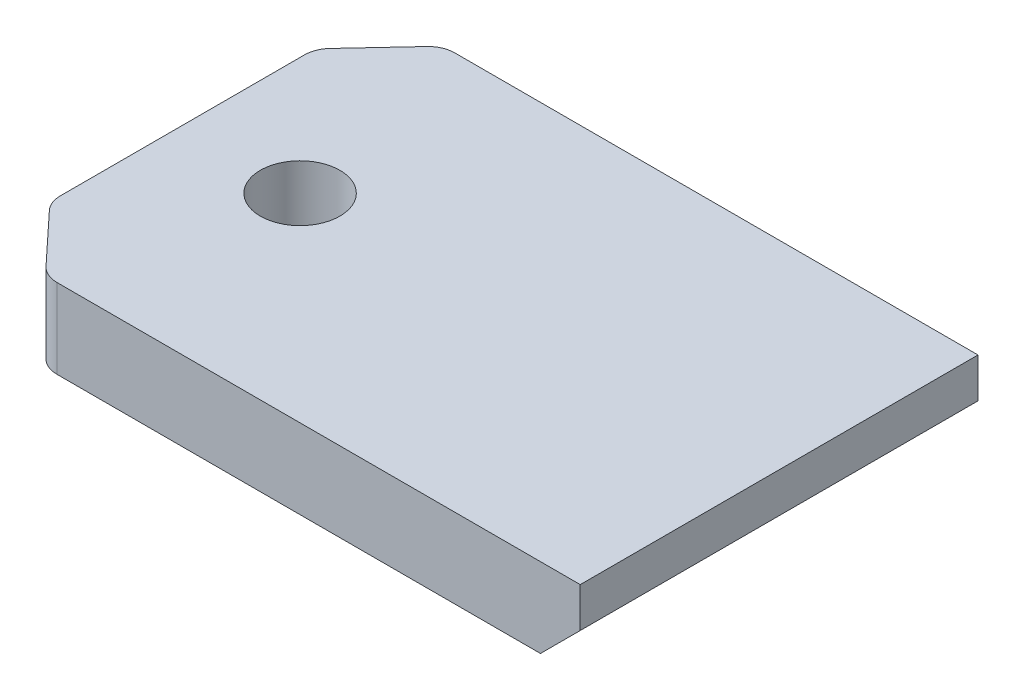
from build123d import *

# Parameters (mm, degrees)
SKETCH_1_W          = 30
SKETCH_1_H          = 6
EXTRUDE_1_DEPTH     = 45
CHAMFER_1_SIZE      = 3
SKETCH_2_R          = 3
CUT_EXTRUDE_1_DEPTH = 55.415071442
CHAMFER_2_SIZE      = 5
CHAMFER_2_SIZE2     = 4.662575431
FILLET_1_R          = 2


with BuildPart() as part:
    # Эскиз1 → Вытянуть1 (new body)
    with BuildSketch(Plane(origin=(0, 0, 0), x_dir=(0, 0, -1), z_dir=(1, 0, 0))):
        with Locations((15, -3)):
            Rectangle(SKETCH_1_W, SKETCH_1_H)
    extrude(amount=EXTRUDE_1_DEPTH)

    # Фаска1
    chamfer_1_edges = [part.edges().sort_by_distance(p)[0] for p in [
        (45, -6, -15),
    ]]
    chamfer(chamfer_1_edges, length=CHAMFER_1_SIZE)

    # Эскиз2 → Вырез-Вытянуть1 (cut, through all)
    with BuildSketch(Plane(origin=(0, 0, 0), x_dir=(-1, 0, 0), z_dir=(0, 1, 0))):
        with Locations((-8.86993337, -14.999999492)):
            Circle(SKETCH_2_R)
    extrude(amount=-CUT_EXTRUDE_1_DEPTH, mode=Mode.SUBTRACT)

    # Фаска2
    chamfer_2_edges = [part.edges().sort_by_distance(p)[0] for p in [
        (0, -3, -30),
        (0, -3, 0),
    ]]
    chamfer_2_side = [part.faces().sort_by_distance(p)[0] for p in [
        (0, -3, -15),
    ]]
    chamfer(chamfer_2_edges, length=CHAMFER_2_SIZE, length2=CHAMFER_2_SIZE2, reference=chamfer_2_side[0])

    # Скругление1
    fillet_1_edges = [part.edges().sort_by_distance(p)[0] for p in [
        (4.662575431, -3, 0),
        (0, -3, -5),
        (0, -3, -25),
        (4.662575431, -3, -30),
    ]]
    fillet(fillet_1_edges, radius=FILLET_1_R)


solid = part.part
